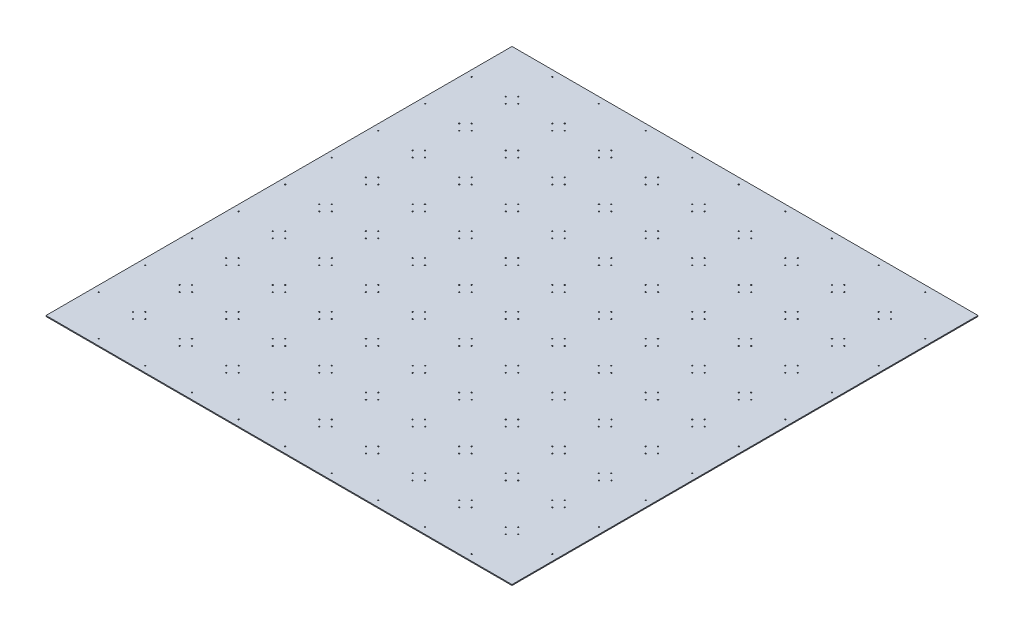
from build123d import *

# Parameters (mm, degrees)
SKETCH1_W            = 3000
SKETCH1_H            = 3000
BOSS_EXTRUDE1_DEPTH  = 6
SKETCH2_R            = 3.5
CUT_EXTRUDE1_DEPTH   = 2122.328828824
LPATTERN1_COUNT      = 10
LPATTERN1_PITCH      = 300
LPATTERN1_COUNT_DIR2 = 9
LPATTERN1_PITCH_DIR2 = 300
SKETCH3_R            = 3.5
CUT_EXTRUDE2_DEPTH   = 2122.328828824
LPATTERN2_COUNT      = 10
LPATTERN2_PITCH      = 300
LPATTERN2_COUNT_DIR2 = 9
LPATTERN2_PITCH_DIR2 = 300


with BuildPart() as part:
    # Sketch1 → Boss-Extrude1 (new body)
    with BuildSketch(Plane(origin=(0, 0, 0), x_dir=(1, 0, 0), z_dir=(0, 1, 0))):
        Rectangle(SKETCH1_W, SKETCH1_H)
    extrude(amount=BOSS_EXTRUDE1_DEPTH)

    # Sketch2 → Cut-Extrude1 (cut, through all)
    with BuildSketch(Plane(origin=(0, 6, 0), x_dir=(1, 0, 0), z_dir=(0, 1, 0))):
        with Locations((-1200, -1240)):
            Circle(SKETCH2_R)
        with Locations((-1200, -1460)):
            Circle(SKETCH2_R)
    cut_extrude1 = extrude(amount=-CUT_EXTRUDE1_DEPTH, mode=Mode.SUBTRACT)

    # LPattern1: Cut-Extrude1 10 × 9
    with Locations(*[(j * LPATTERN1_PITCH_DIR2, 0, -i * LPATTERN1_PITCH) for i in range(LPATTERN1_COUNT) for j in range(LPATTERN1_COUNT_DIR2) if (i, j) != (0, 0)]):
        add(cut_extrude1, mode=Mode.SUBTRACT)

    # Sketch3 → Cut-Extrude2 (cut, through all)
    with BuildSketch(Plane(origin=(0, 6, 0), x_dir=(1, 0, 0), z_dir=(0, 1, 0))):
        with Locations((-1460, -1200)):
            Circle(SKETCH3_R)
        with Locations((-1240, -1200)):
            Circle(SKETCH3_R)
    cut_extrude2 = extrude(amount=-CUT_EXTRUDE2_DEPTH, mode=Mode.SUBTRACT)

    # LPattern2: Cut-Extrude2 10 × 9
    with Locations(*[(i * LPATTERN2_PITCH, 0, -j * LPATTERN2_PITCH_DIR2) for i in range(LPATTERN2_COUNT) for j in range(LPATTERN2_COUNT_DIR2) if (i, j) != (0, 0)]):
        add(cut_extrude2, mode=Mode.SUBTRACT)


solid = part.part
